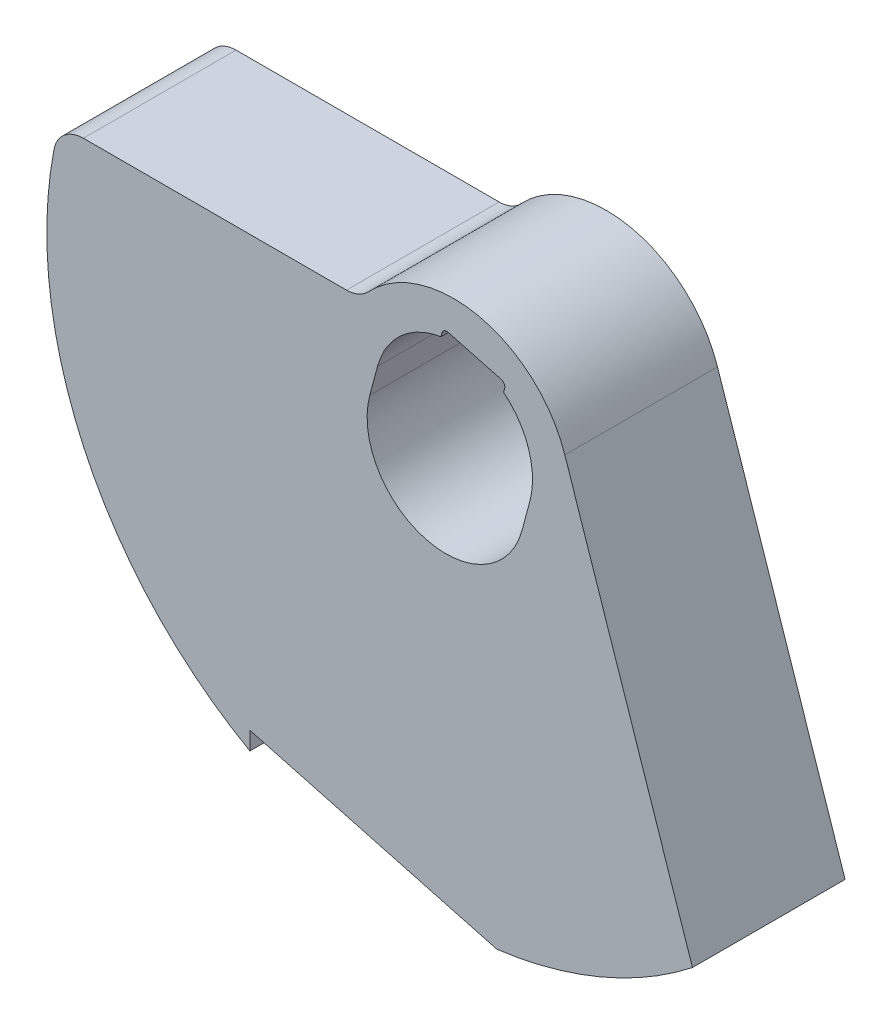
from build123d import *

# Parameters (mm, degrees)
SKETCH1_R               = 1.1938
BOSS_EXTRUDE1_DEPTH     = 7.7724
CUT_EXTRUDE1_DEPTH      = 30.656212081
CUT_EXTRUDE1_DEPTH_BACK = 30.656212081


with BuildPart() as part:
    # Sketch1 → Boss-Extrude1 (new body)
    with BuildSketch(Plane.XY):
        with BuildLine():
            ThreePointArc((-3.95481445, 5.560217822), (-4.460344292, 5.205196933), (-5.065262452, 5.08))
            Line((-5.065262452, 5.08), (-18.456556559, 5.08))
            ThreePointArc((-18.456556559, 5.08), (-19.426909517, 4.731155792), (-19.953034117, 3.844324324))
            ThreePointArc((-19.953034117, 3.844324324), (-18.44069754, -8.534815418), (-9.9822, -17.699098371))
            Line((-9.9822, -17.699098371), (-9.9822, -16.784328658))
            Line((-9.9822, -16.784328658), (2.593084415, -20.153865962))
            ThreePointArc((2.593084415, -20.153865962), (10.900004065, -17.149119843), (17.146958643, -10.903403565))
            Line((17.146958643, -10.903403565), (12.940315476, -3.61728387))
            ThreePointArc((12.940315476, -3.61728387), (12.796393961, -3.475289825), (12.60008731, -3.426922378))
            ThreePointArc((12.60008731, -3.426922378), (9.17217903, -2.398369889), (7.028137334, 0.467212181))
            Line((7.028137334, 0.467212181), (6.053096787, 3.371693793))
            ThreePointArc((6.053096787, 3.371693793), (1.669604011, 7.303273092), (-3.95481445, 5.560217822))
        make_face()
        with Locations((12.7, -9.398)):
            Circle(SKETCH1_R, mode=Mode.SUBTRACT)
        with BuildLine():
            ThreePointArc((3.876453526, -1.038692592), (-1.038692592, -3.876453526), (-3.876453526, 1.038692592))
            Line((-3.876453526, 1.038692592), (-3.482013301, 2.510763551))
            ThreePointArc((-3.482013301, 2.510763551), (-2.298514325, 4.447599489), (-0.253578298, 5.432607064))
            Line((-0.253578298, 5.432607064), (-0.201054745, 5.628627633))
            ThreePointArc((-0.201054745, 5.628627633), (-0.082709585, 5.782858048), (0.110030452, 5.808232755))
            Line((0.110030452, 5.808232755), (2.808827211, 5.085092343))
            ThreePointArc((2.808827211, 5.085092343), (2.963057626, 4.966747183), (2.988432333, 4.774007146))
            Line((2.988432333, 4.774007146), (2.93590878, 4.577986577))
            ThreePointArc((2.93590878, 4.577986577), (4.214371541, 2.702476981), (4.270893751, 0.433378367))
            Line((4.270893751, 0.433378367), (3.876453526, -1.038692592))
        make_face(mode=Mode.SUBTRACT)
    extrude(amount=-BOSS_EXTRUDE1_DEPTH)

    # Sketch2 → Cut-Extrude1 (cut, two sides: drawn at the far end of the back side and taken through both)
    with BuildSketch(Plane.XY.offset(-CUT_EXTRUDE1_DEPTH_BACK)):
        Polygon((-21.844195139, 86.473029104), (7.028137334, 0.467212181), (12.549933302, -15.98128825), (41.422265775, -101.987105173), (213.433899622, -44.242440226), (150.167438707, 144.217694051), align=None)
    extrude(amount=CUT_EXTRUDE1_DEPTH + CUT_EXTRUDE1_DEPTH_BACK, mode=Mode.SUBTRACT)


solid = part.part
